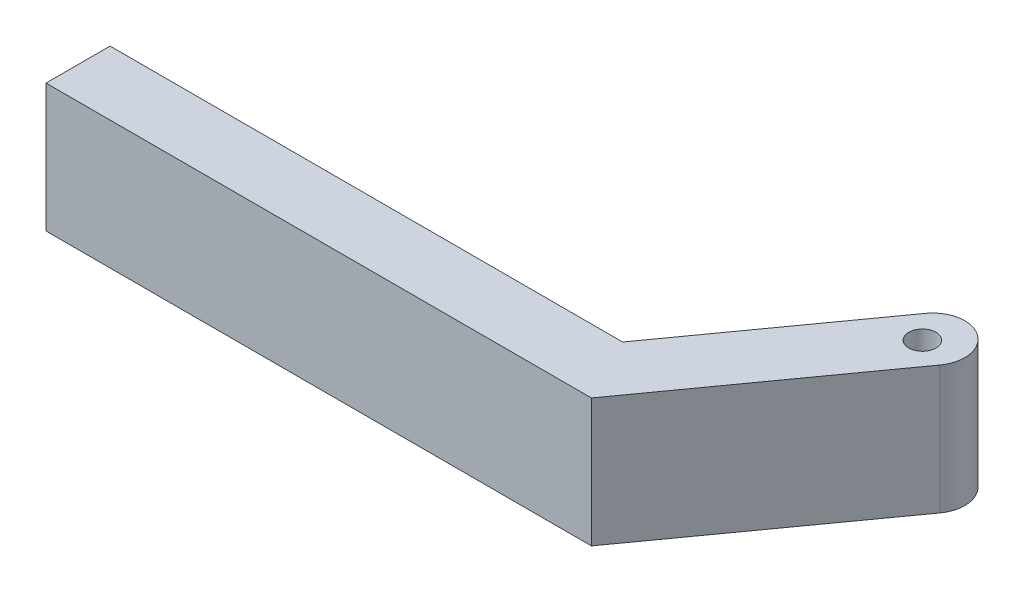
from build123d import *

# Parameters (mm, degrees)
BOSS_EXTRUDE1_DEPTH   = 12.7
F_6_32_TAPPED_HOLE1_D = 2.7051


with BuildPart() as part:
    # Sketch2 → Boss-Extrude1 (new body)
    with BuildSketch(Plane(origin=(0, 0, 0), x_dir=(1, 0, 0), z_dir=(0, 1, 0))):
        with BuildLine():
            Line((-12.539178872, -37.888008427), (0.0062465, -20.425508427))
            ThreePointArc((0.0062465, -20.425508427), (4.437282293, -19.699442449), (5.163348271, -24.130478242))
            Line((5.163348271, -24.130478242), (-9.282322129, -44.238008427))
            Line((-9.282322129, -44.238008427), (-12.539178872, -44.238008427))
            Line((-12.539178872, -44.238008427), (-63.339178872, -44.238008427))
            Line((-63.339178872, -44.238008427), (-63.339178872, -37.888008427))
            Line((-63.339178872, -37.888008427), (-12.539178872, -37.888008427))
        make_face()
    extrude(amount=BOSS_EXTRUDE1_DEPTH)

    # #6-32 Tapped Hole1 (through all)
    with Locations(Plane(origin=(0, 12.7, 0), x_dir=(1, 0, 0), z_dir=(0, 1, 0))):
        with Locations((2.156295862, -22.874442449)):
            Hole(F_6_32_TAPPED_HOLE1_D / 2)


solid = part.part
